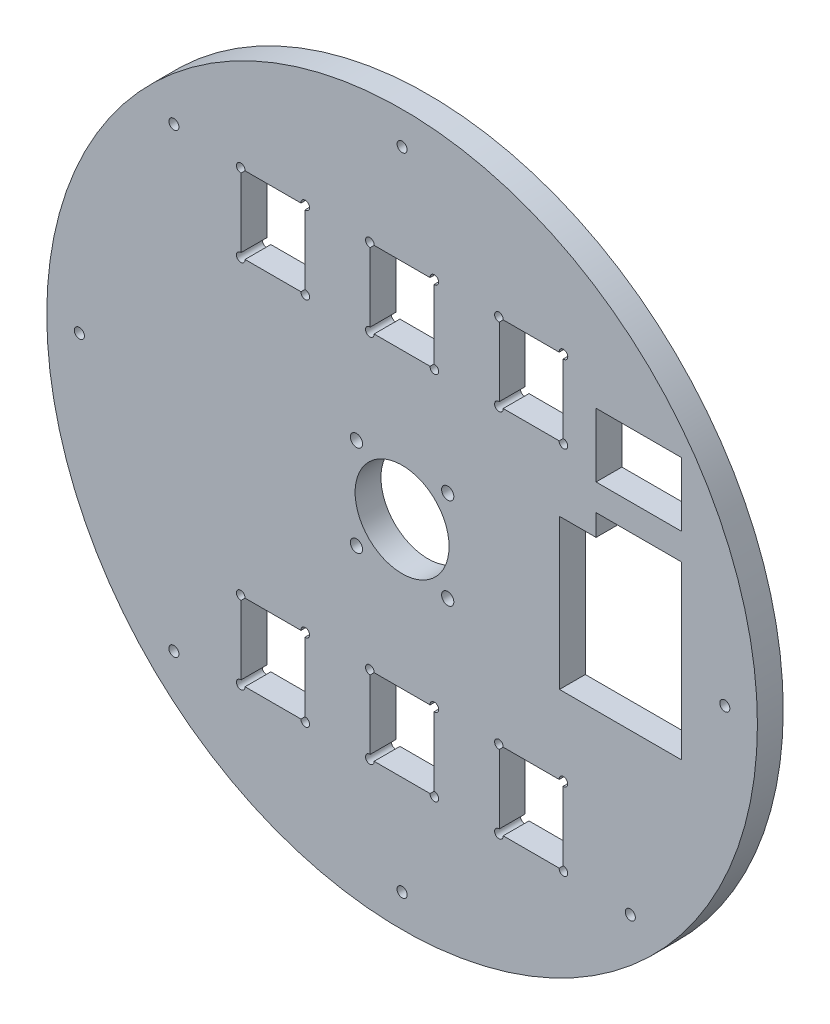
from build123d import *

# Parameters (mm, degrees)
SKETCH1_R              = 82.5
SKETCH1_R_2            = 11
SKETCH1_R_3            = 1.5
SKETCH1_R_4            = 1.25
BOSS_EXTRUDE1_DEPTH    = 6
SKETCH8_W              = 20
SKETCH8_H              = 15
CUT_EXTRUDE5_DEPTH     = 117.826794872
SKETCH9_W              = 15
SKETCH9_H              = 18
CUT_EXTRUDE6_DEPTH     = 117.826794872
SKETCH10_R             = 1
CUT_EXTRUDE7_DEPTH     = 117.826794872
MOVE_FACE1_OUTLINE_R   = 82.58
MOVE_FACE1_OUTLINE_R_2 = 82.5
MOVE_FACE1_OUTLINE_R_3 = 11
MOVE_FACE1_OUTLINE_R_4 = 10.92
MOVE_FACE1_OUTLINE_R_5 = 1.5
MOVE_FACE1_OUTLINE_R_6 = 1.42
MOVE_FACE1_OUTLINE_R_7 = 1.25
MOVE_FACE1_OUTLINE_R_8 = 1.17
MOVE_FACE1_OUTLINE_W   = 20
MOVE_FACE1_OUTLINE_H   = 15
MOVE_FACE1_OUTLINE_W_2 = 19.84
MOVE_FACE1_OUTLINE_H_2 = 14.84
MOVE_FACE1_DEPTH       = 6


with BuildPart() as part:
    # Sketch1 → Boss-Extrude1 (new body)
    with BuildSketch(Plane.XY):
        Circle(SKETCH1_R)
        Circle(SKETCH1_R_2, mode=Mode.SUBTRACT)
        with Locations((10.606601718, -10.606601718)):
            Circle(SKETCH1_R_3, mode=Mode.SUBTRACT)
        with Locations((0, -75)):
            Circle(SKETCH1_R_4, mode=Mode.SUBTRACT)
        with Locations((-10.606601718, -10.606601718)):
            Circle(SKETCH1_R_3, mode=Mode.SUBTRACT)
        with Locations((-10.606601718, 10.606601718)):
            Circle(SKETCH1_R_3, mode=Mode.SUBTRACT)
        with Locations((10.606601718, 10.606601718)):
            Circle(SKETCH1_R_3, mode=Mode.SUBTRACT)
        with Locations((-53.033008589, -53.033008589)):
            Circle(SKETCH1_R_4, mode=Mode.SUBTRACT)
        with Locations((-75, 0)):
            Circle(SKETCH1_R_4, mode=Mode.SUBTRACT)
        with Locations((-53.033008589, 53.033008589)):
            Circle(SKETCH1_R_4, mode=Mode.SUBTRACT)
        with Locations((0, 75)):
            Circle(SKETCH1_R_4, mode=Mode.SUBTRACT)
        with Locations((75, 0)):
            Circle(SKETCH1_R_4, mode=Mode.SUBTRACT)
        with Locations((53.033008589, -53.033008589)):
            Circle(SKETCH1_R_4, mode=Mode.SUBTRACT)
    extrude(amount=BOSS_EXTRUDE1_DEPTH)

    # Sketch8 → Cut-Extrude5 (cut, through all)
    with BuildSketch(Plane.XY.offset(6)):
        Polygon((45, 24), (65, 24), (65, -16), (36.5, -16), (36.5, 19), (45, 19), align=None)
        with Locations((55, 37.5)):
            Rectangle(SKETCH8_W, SKETCH8_H)
    extrude(amount=-CUT_EXTRUDE5_DEPTH, mode=Mode.SUBTRACT)

    # Sketch9 → Cut-Extrude6 (cut, through all)
    with BuildSketch(Plane.XY.offset(6)):
        with Locations((-30, -43)):
            Rectangle(SKETCH9_W, SKETCH9_H)
        with Locations((-30, 43)):
            Rectangle(SKETCH9_W, SKETCH9_H)
        with Locations((30, 43)):
            Rectangle(SKETCH9_W, SKETCH9_H)
        with Locations((0, -43)):
            Rectangle(SKETCH9_W, SKETCH9_H)
        with Locations((30, -43)):
            Rectangle(SKETCH9_W, SKETCH9_H)
        with Locations((0, 43)):
            Rectangle(SKETCH9_W, SKETCH9_H)
    extrude(amount=-CUT_EXTRUDE6_DEPTH, mode=Mode.SUBTRACT)

    # Sketch10 → Cut-Extrude7 (cut, through all)
    with BuildSketch(Plane.XY.offset(6)):
        with Locations((-37.5, 52)):
            Circle(SKETCH10_R)
        with Locations((-22.5, 52)):
            Circle(SKETCH10_R)
        with Locations((-37.5, 34)):
            Circle(SKETCH10_R)
        with Locations((-22.5, 34)):
            Circle(SKETCH10_R)
        with Locations((-7.5, 52)):
            Circle(SKETCH10_R)
        with Locations((7.5, 52)):
            Circle(SKETCH10_R)
        with Locations((-7.5, 34)):
            Circle(SKETCH10_R)
        with Locations((7.5, 34)):
            Circle(SKETCH10_R)
        with Locations((22.5, 52)):
            Circle(SKETCH10_R)
        with Locations((37.5, 52)):
            Circle(SKETCH10_R)
        with Locations((22.5, 34)):
            Circle(SKETCH10_R)
        with Locations((37.5, 34)):
            Circle(SKETCH10_R)
        with Locations((-37.5, -34)):
            Circle(SKETCH10_R)
        with Locations((-22.5, -34)):
            Circle(SKETCH10_R)
        with Locations((-37.5, -52)):
            Circle(SKETCH10_R)
        with Locations((-22.5, -52)):
            Circle(SKETCH10_R)
        with Locations((-7.5, -34)):
            Circle(SKETCH10_R)
        with Locations((7.5, -34)):
            Circle(SKETCH10_R)
        with Locations((-7.5, -52)):
            Circle(SKETCH10_R)
        with Locations((7.5, -52)):
            Circle(SKETCH10_R)
        with Locations((22.5, -34)):
            Circle(SKETCH10_R)
        with Locations((37.5, -34)):
            Circle(SKETCH10_R)
        with Locations((22.5, -52)):
            Circle(SKETCH10_R)
        with Locations((37.5, -52)):
            Circle(SKETCH10_R)
    extrude(amount=-CUT_EXTRUDE7_DEPTH, mode=Mode.SUBTRACT)

    # Move Face1: read off the stored shape, not the designer's step
    # Move Face1 outline → Move Face1 (add)
    # profile 1 of 39: a face of its own
    with BuildSketch(Plane.XY):
        Circle(MOVE_FACE1_OUTLINE_R)
        Circle(MOVE_FACE1_OUTLINE_R_2, mode=Mode.SUBTRACT)
    # profile 2 of 39: a face of its own
    with BuildSketch(Plane.XY):
        with BuildLine():
            Line((-37.42, -51.003205136), (-37.42, -34.996794864))
            ThreePointArc((-37.42, -34.996794864), (-37.45996791, -34.999198395), (-37.5, -35))
            Line((-37.5, -35), (-37.5, -51))
            ThreePointArc((-37.5, -51), (-37.45996791, -51.000801605), (-37.42, -51.003205136))
        make_face()
    # profile 3 of 39: a face of its own
    with BuildSketch(Plane.XY):
        with BuildLine():
            Line((-23.5, -34), (-36.5, -34))
            ThreePointArc((-36.5, -34), (-36.500801605, -34.04003209), (-36.503205136, -34.08))
            Line((-36.503205136, -34.08), (-23.496794864, -34.08))
            ThreePointArc((-23.496794864, -34.08), (-23.499198395, -34.04003209), (-23.5, -34))
        make_face()
    # profile 4 of 39: a face of its own
    with BuildSketch(Plane.XY):
        with BuildLine():
            ThreePointArc((-36.503205136, -51.92), (-36.500801605, -51.95996791), (-36.5, -52))
            Line((-36.5, -52), (-23.5, -52))
            ThreePointArc((-23.5, -52), (-23.499198395, -51.95996791), (-23.496794864, -51.92))
            Line((-23.496794864, -51.92), (-36.503205136, -51.92))
        make_face()
    # profile 5 of 39: a face of its own
    with BuildSketch(Plane.XY):
        with BuildLine():
            Line((-22.5, -51), (-22.5, -35))
            ThreePointArc((-22.5, -35), (-22.54003209, -34.999198395), (-22.58, -34.996794864))
            Line((-22.58, -34.996794864), (-22.58, -51.003205136))
            ThreePointArc((-22.58, -51.003205136), (-22.54003209, -51.000801605), (-22.5, -51))
        make_face()
    # profile 6 of 39: a face of its own
    with BuildSketch(Plane.XY):
        with BuildLine():
            Line((-37.42, 34.996794864), (-37.42, 51.003205136))
            ThreePointArc((-37.42, 51.003205136), (-37.45996791, 51.000801605), (-37.5, 51))
            Line((-37.5, 51), (-37.5, 35))
            ThreePointArc((-37.5, 35), (-37.45996791, 34.999198395), (-37.42, 34.996794864))
        make_face()
    # profile 7 of 39: a face of its own
    with BuildSketch(Plane.XY):
        with BuildLine():
            Line((-23.5, 52), (-36.5, 52))
            ThreePointArc((-36.5, 52), (-36.500801605, 51.95996791), (-36.503205136, 51.92))
            Line((-36.503205136, 51.92), (-23.496794864, 51.92))
            ThreePointArc((-23.496794864, 51.92), (-23.499198395, 51.95996791), (-23.5, 52))
        make_face()
    # profile 8 of 39: a face of its own
    with BuildSketch(Plane.XY):
        with BuildLine():
            ThreePointArc((-36.503205136, 34.08), (-36.500801605, 34.04003209), (-36.5, 34))
            Line((-36.5, 34), (-23.5, 34))
            ThreePointArc((-23.5, 34), (-23.499198395, 34.04003209), (-23.496794864, 34.08))
            Line((-23.496794864, 34.08), (-36.503205136, 34.08))
        make_face()
    # profile 9 of 39: a face of its own
    with BuildSketch(Plane.XY):
        with BuildLine():
            Line((-22.5, 35), (-22.5, 51))
            ThreePointArc((-22.5, 51), (-22.54003209, 51.000801605), (-22.58, 51.003205136))
            Line((-22.58, 51.003205136), (-22.58, 34.996794864))
            ThreePointArc((-22.58, 34.996794864), (-22.54003209, 34.999198395), (-22.5, 35))
        make_face()
    # profile 10 of 39: a face of its own
    with BuildSketch(Plane.XY):
        with BuildLine():
            Line((-6.503205136, -34.08), (6.503205136, -34.08))
            ThreePointArc((6.503205136, -34.08), (6.500801605, -34.04003209), (6.5, -34))
            Line((6.5, -34), (-6.5, -34))
            ThreePointArc((-6.5, -34), (-6.500801605, -34.04003209), (-6.503205136, -34.08))
        make_face()
    # profile 11 of 39: a face of its own
    with BuildSketch(Plane.XY):
        with BuildLine():
            Line((7.5, -51), (7.5, -35))
            ThreePointArc((7.5, -35), (7.45996791, -34.999198395), (7.42, -34.996794864))
            Line((7.42, -34.996794864), (7.42, -51.003205136))
            ThreePointArc((7.42, -51.003205136), (7.45996791, -51.000801605), (7.5, -51))
        make_face()
    # profile 12 of 39: a face of its own
    with BuildSketch(Plane.XY):
        with BuildLine():
            ThreePointArc((-7.42, -34.996794864), (-7.45996791, -34.999198395), (-7.5, -35))
            Line((-7.5, -35), (-7.5, -51))
            ThreePointArc((-7.5, -51), (-7.45996791, -51.000801605), (-7.42, -51.003205136))
            Line((-7.42, -51.003205136), (-7.42, -34.996794864))
        make_face()
    # profile 13 of 39: a face of its own
    with BuildSketch(Plane.XY):
        with BuildLine():
            Line((-6.5, -52), (6.5, -52))
            ThreePointArc((6.5, -52), (6.500801605, -51.95996791), (6.503205136, -51.92))
            Line((6.503205136, -51.92), (-6.503205136, -51.92))
            ThreePointArc((-6.503205136, -51.92), (-6.500801605, -51.95996791), (-6.5, -52))
        make_face()
    # profile 14 of 39: a face of its own
    with BuildSketch(Plane.XY):
        with BuildLine():
            Line((23.496794864, -34.08), (36.503205136, -34.08))
            ThreePointArc((36.503205136, -34.08), (36.500801605, -34.04003209), (36.5, -34))
            Line((36.5, -34), (23.5, -34))
            ThreePointArc((23.5, -34), (23.499198395, -34.04003209), (23.496794864, -34.08))
        make_face()
    # profile 15 of 39: a face of its own
    with BuildSketch(Plane.XY):
        with BuildLine():
            Line((37.5, -51), (37.5, -35))
            ThreePointArc((37.5, -35), (37.45996791, -34.999198395), (37.42, -34.996794864))
            Line((37.42, -34.996794864), (37.42, -51.003205136))
            ThreePointArc((37.42, -51.003205136), (37.45996791, -51.000801605), (37.5, -51))
        make_face()
    # profile 16 of 39: a face of its own
    with BuildSketch(Plane.XY):
        with BuildLine():
            ThreePointArc((22.58, -34.996794864), (22.54003209, -34.999198395), (22.5, -35))
            Line((22.5, -35), (22.5, -51))
            ThreePointArc((22.5, -51), (22.54003209, -51.000801605), (22.58, -51.003205136))
            Line((22.58, -51.003205136), (22.58, -34.996794864))
        make_face()
    # profile 17 of 39: a face of its own
    with BuildSketch(Plane.XY):
        with BuildLine():
            Line((23.5, -52), (36.5, -52))
            ThreePointArc((36.5, -52), (36.500801605, -51.95996791), (36.503205136, -51.92))
            Line((36.503205136, -51.92), (23.496794864, -51.92))
            ThreePointArc((23.496794864, -51.92), (23.499198395, -51.95996791), (23.5, -52))
        make_face()
    # profile 18 of 39: a face of its own
    with BuildSketch(Plane.XY):
        with BuildLine():
            Line((23.496794864, 51.92), (36.503205136, 51.92))
            ThreePointArc((36.503205136, 51.92), (36.500801605, 51.95996791), (36.5, 52))
            Line((36.5, 52), (23.5, 52))
            ThreePointArc((23.5, 52), (23.499198395, 51.95996791), (23.496794864, 51.92))
        make_face()
    # profile 19 of 39: a face of its own
    with BuildSketch(Plane.XY):
        with BuildLine():
            Line((37.5, 35), (37.5, 51))
            ThreePointArc((37.5, 51), (37.45996791, 51.000801605), (37.42, 51.003205136))
            Line((37.42, 51.003205136), (37.42, 34.996794864))
            ThreePointArc((37.42, 34.996794864), (37.45996791, 34.999198395), (37.5, 35))
        make_face()
    # profile 20 of 39: a face of its own
    with BuildSketch(Plane.XY):
        with BuildLine():
            ThreePointArc((22.58, 51.003205136), (22.54003209, 51.000801605), (22.5, 51))
            Line((22.5, 51), (22.5, 35))
            ThreePointArc((22.5, 35), (22.54003209, 34.999198395), (22.58, 34.996794864))
            Line((22.58, 34.996794864), (22.58, 51.003205136))
        make_face()
    # profile 21 of 39: a face of its own
    with BuildSketch(Plane.XY):
        with BuildLine():
            Line((23.5, 34), (36.5, 34))
            ThreePointArc((36.5, 34), (36.500801605, 34.04003209), (36.503205136, 34.08))
            Line((36.503205136, 34.08), (23.496794864, 34.08))
            ThreePointArc((23.496794864, 34.08), (23.499198395, 34.04003209), (23.5, 34))
        make_face()
    # profile 22 of 39: a face of its own
    with BuildSketch(Plane.XY):
        with BuildLine():
            Line((-6.503205136, 51.92), (6.503205136, 51.92))
            ThreePointArc((6.503205136, 51.92), (6.500801605, 51.95996791), (6.5, 52))
            Line((6.5, 52), (-6.5, 52))
            ThreePointArc((-6.5, 52), (-6.500801605, 51.95996791), (-6.503205136, 51.92))
        make_face()
    # profile 23 of 39: a face of its own
    with BuildSketch(Plane.XY):
        with BuildLine():
            Line((7.5, 35), (7.5, 51))
            ThreePointArc((7.5, 51), (7.45996791, 51.000801605), (7.42, 51.003205136))
            Line((7.42, 51.003205136), (7.42, 34.996794864))
            ThreePointArc((7.42, 34.996794864), (7.45996791, 34.999198395), (7.5, 35))
        make_face()
    # profile 24 of 39: a face of its own
    with BuildSketch(Plane.XY):
        with BuildLine():
            ThreePointArc((-7.42, 51.003205136), (-7.45996791, 51.000801605), (-7.5, 51))
            Line((-7.5, 51), (-7.5, 35))
            ThreePointArc((-7.5, 35), (-7.45996791, 34.999198395), (-7.42, 34.996794864))
            Line((-7.42, 34.996794864), (-7.42, 51.003205136))
        make_face()
    # profile 25 of 39: a face of its own
    with BuildSketch(Plane.XY):
        with BuildLine():
            Line((-6.5, 34), (6.5, 34))
            ThreePointArc((6.5, 34), (6.500801605, 34.04003209), (6.503205136, 34.08))
            Line((6.503205136, 34.08), (-6.503205136, 34.08))
            ThreePointArc((-6.503205136, 34.08), (-6.500801605, 34.04003209), (-6.5, 34))
        make_face()
    # profile 26 of 39: a face of its own
    with BuildSketch(Plane.XY):
        Circle(MOVE_FACE1_OUTLINE_R_3)
        Circle(MOVE_FACE1_OUTLINE_R_4, mode=Mode.SUBTRACT)
    # profile 27 of 39: a face of its own
    with BuildSketch(Plane.XY):
        with Locations((10.606601718, -10.606601718)):
            Circle(MOVE_FACE1_OUTLINE_R_5)
        with Locations((10.606601718, -10.606601718)):
            Circle(MOVE_FACE1_OUTLINE_R_6, mode=Mode.SUBTRACT)
    # profile 28 of 39: a face of its own
    with BuildSketch(Plane.XY):
        with Locations((0, -75)):
            Circle(MOVE_FACE1_OUTLINE_R_7)
        with Locations((0, -75)):
            Circle(MOVE_FACE1_OUTLINE_R_8, mode=Mode.SUBTRACT)
    # profile 29 of 39: a face of its own
    with BuildSketch(Plane.XY):
        with Locations((-10.606601718, -10.606601718)):
            Circle(MOVE_FACE1_OUTLINE_R_5)
        with Locations((-10.606601718, -10.606601718)):
            Circle(MOVE_FACE1_OUTLINE_R_6, mode=Mode.SUBTRACT)
    # profile 30 of 39: a face of its own
    with BuildSketch(Plane.XY):
        with Locations((-10.606601718, 10.606601718)):
            Circle(MOVE_FACE1_OUTLINE_R_5)
        with Locations((-10.606601718, 10.606601718)):
            Circle(MOVE_FACE1_OUTLINE_R_6, mode=Mode.SUBTRACT)
    # profile 31 of 39: a face of its own
    with BuildSketch(Plane.XY):
        with Locations((10.606601718, 10.606601718)):
            Circle(MOVE_FACE1_OUTLINE_R_5)
        with Locations((10.606601718, 10.606601718)):
            Circle(MOVE_FACE1_OUTLINE_R_6, mode=Mode.SUBTRACT)
    # profile 32 of 39: a face of its own
    with BuildSketch(Plane.XY):
        with Locations((-53.033008589, -53.033008589)):
            Circle(MOVE_FACE1_OUTLINE_R_7)
        with Locations((-53.033008589, -53.033008589)):
            Circle(MOVE_FACE1_OUTLINE_R_8, mode=Mode.SUBTRACT)
    # profile 33 of 39: a face of its own
    with BuildSketch(Plane.XY):
        with Locations((-75, 0)):
            Circle(MOVE_FACE1_OUTLINE_R_7)
        with Locations((-75, 0)):
            Circle(MOVE_FACE1_OUTLINE_R_8, mode=Mode.SUBTRACT)
    # profile 34 of 39: a face of its own
    with BuildSketch(Plane.XY):
        with Locations((-53.033008589, 53.033008589)):
            Circle(MOVE_FACE1_OUTLINE_R_7)
        with Locations((-53.033008589, 53.033008589)):
            Circle(MOVE_FACE1_OUTLINE_R_8, mode=Mode.SUBTRACT)
    # profile 35 of 39: a face of its own
    with BuildSketch(Plane.XY):
        with Locations((0, 75)):
            Circle(MOVE_FACE1_OUTLINE_R_7)
        with Locations((0, 75)):
            Circle(MOVE_FACE1_OUTLINE_R_8, mode=Mode.SUBTRACT)
    # profile 36 of 39: a face of its own
    with BuildSketch(Plane.XY):
        with Locations((75, 0)):
            Circle(MOVE_FACE1_OUTLINE_R_7)
        with Locations((75, 0)):
            Circle(MOVE_FACE1_OUTLINE_R_8, mode=Mode.SUBTRACT)
    # profile 37 of 39: a face of its own
    with BuildSketch(Plane.XY):
        with Locations((53.033008589, -53.033008589)):
            Circle(MOVE_FACE1_OUTLINE_R_7)
        with Locations((53.033008589, -53.033008589)):
            Circle(MOVE_FACE1_OUTLINE_R_8, mode=Mode.SUBTRACT)
    # profile 38 of 39: a face of its own
    with BuildSketch(Plane.XY):
        with Locations((55, 37.5)):
            Rectangle(MOVE_FACE1_OUTLINE_W, MOVE_FACE1_OUTLINE_H)
        with Locations((55, 37.5)):
            Rectangle(MOVE_FACE1_OUTLINE_W_2, MOVE_FACE1_OUTLINE_H_2, mode=Mode.SUBTRACT)
    # profile 39 of 39: a face of its own
    with BuildSketch(Plane.XY):
        Polygon((65, 24), (45, 24), (45, 19), (36.5, 19), (36.5, -16), (65, -16), align=None)
        Polygon((45.08, 18.92), (45.08, 23.92), (64.92, 23.92), (64.92, -15.92), (36.58, -15.92), (36.58, 18.92), align=None, mode=Mode.SUBTRACT)
    extrude(amount=MOVE_FACE1_DEPTH)


solid = part.part
